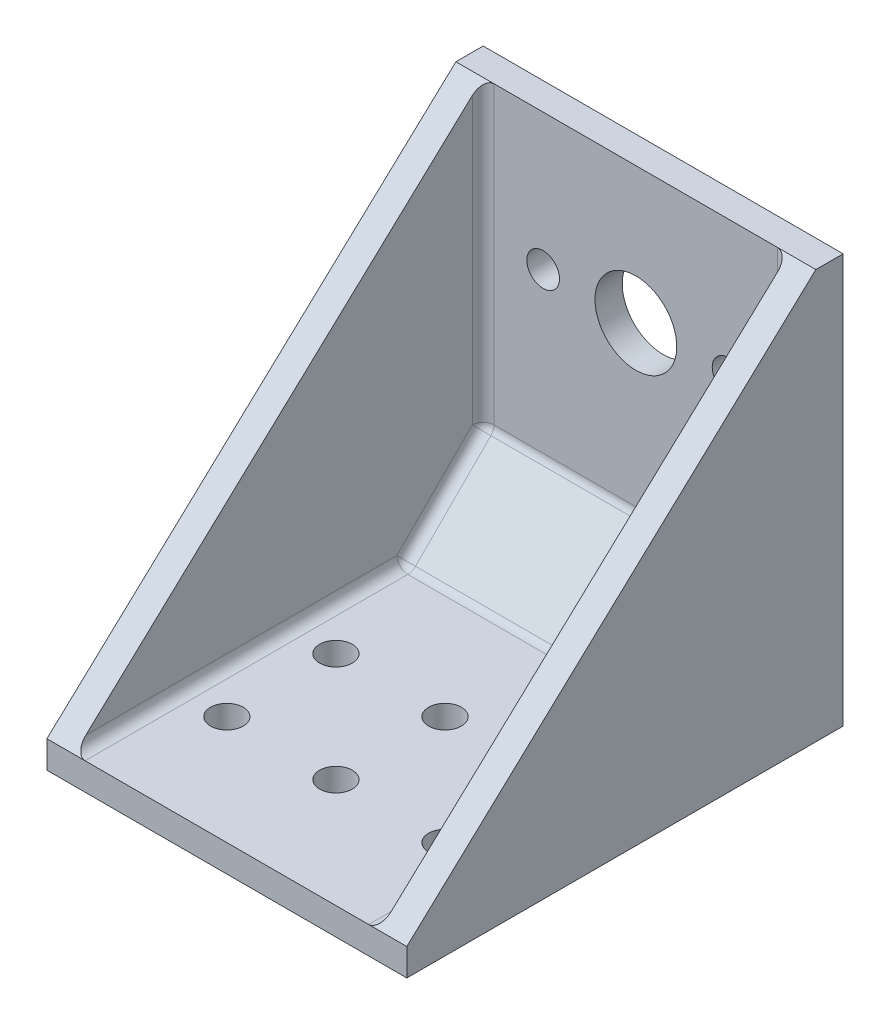
from build123d import *

# Parameters (mm, degrees)
BOSS_EXTRUDE1_DEPTH            = 28
BOSS_EXTRUDE2_DEPTH            = 2.5
BOSS_EXTRUDE3_DEPTH            = 2.5
SKETCH4_W                      = 33
SKETCH4_H                      = 40
BOSS_EXTRUDE4_DEPTH            = 2.5
F_3_0_3_DIAMETER_HOLE1_D       = 3
F_3_0_3_DIAMETER_HOLE1_DEPTH   = 37.500025
F_7_5_7_5_DIAMETER_HOLE1_D     = 7.5
F_7_5_7_5_DIAMETER_HOLE1_DEPTH = 40
F_3_0_3_DIAMETER_HOLE2_D       = 3
F_3_0_3_DIAMETER_HOLE2_DEPTH   = 40
FILLET1_R                      = 1


with BuildPart() as part:
    # Boss-Extrude1: read off the stored shape, not the designer's step
    # Boss-Extrude1 outline → Boss-Extrude1 (new body)
    with BuildSketch(Plane.YZ):
        Polygon((2.5, 0), (37.5, 0), (37.5, 2.5), (10, 2.5), (2.5, 10), align=None)
    extrude(amount=BOSS_EXTRUDE1_DEPTH)

    # Sketch2 → Boss-Extrude2 (add)
    with BuildSketch(Plane(origin=(28, 0, 0), x_dir=(0, 0, -1), z_dir=(1, 0, 0))):
        Polygon((0, 2.5), (-40, 2.5), (-2.5, 37.5), (0, 37.5), align=None)
    extrude(amount=BOSS_EXTRUDE2_DEPTH)

    # Sketch3 → Boss-Extrude3 (add)
    with BuildSketch(Plane.ZY):
        Polygon((40, 2.5), (0, 2.5), (0, 37.5), (2.5, 37.5), align=None)
    extrude(amount=BOSS_EXTRUDE3_DEPTH)

    # Sketch4 → Boss-Extrude4 (add)
    with BuildSketch(Plane.XZ.offset(-2.5)):
        with Locations((14, 20)):
            Rectangle(SKETCH4_W, SKETCH4_H)
    extrude(amount=BOSS_EXTRUDE4_DEPTH)

    # Ø3.0 (3) Diameter Hole1
    with Locations(Plane(origin=(0, 0, 0), x_dir=(-1, 0, 0), z_dir=(0, -1, 0))):
        with Locations((-4, -30), (-4, -20), (-14, -30), (-14, -20), (-24, -30), (-24, -20)):
            Hole(F_3_0_3_DIAMETER_HOLE1_D / 2, depth=F_3_0_3_DIAMETER_HOLE1_DEPTH)

    # Ø7.5 (7.5) Diameter Hole1
    with Locations(Plane(origin=(0, 0, 0), x_dir=(-1, 0, 0), z_dir=(0, 0, -1))):
        with Locations((-14, 25)):
            Hole(F_7_5_7_5_DIAMETER_HOLE1_D / 2, depth=F_7_5_7_5_DIAMETER_HOLE1_DEPTH)

    # Ø3.0 (3) Diameter Hole2
    with Locations(Plane(origin=(0, 0, 0), x_dir=(-1, 0, 0), z_dir=(0, 0, -1))):
        with Locations((-22.5, 25), (-5.5, 25)):
            Hole(F_3_0_3_DIAMETER_HOLE2_D / 2, depth=F_3_0_3_DIAMETER_HOLE2_DEPTH)

    # Fillet1
    fillet1_edges = [part.edges().sort_by_distance(p)[0] for p in [
        (14, 2.5, 10),
        (0, 6.25, 6.25),
        (28, 6.25, 6.25),
        (14, 10, 2.5),
        (0, 23.75, 2.5),
        (28, 23.75, 2.5),
        (28, 2.5, 25),
        (0, 2.5, 25),
    ]]
    fillet(fillet1_edges, radius=FILLET1_R)


solid = part.part
